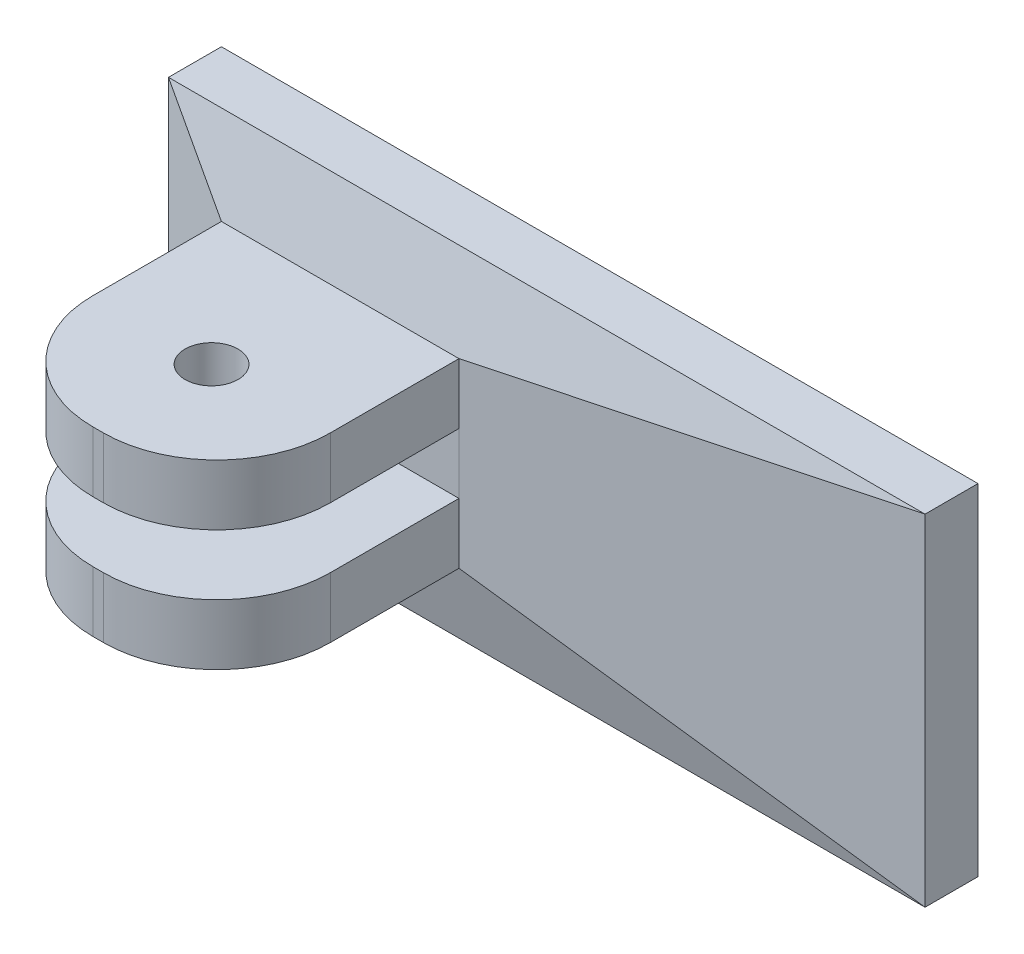
from build123d import *

# Parameters (mm, degrees)
SKETCH1_W           = 100
SKETCH1_H           = 45
BOSS_EXTRUDE1_DEPTH = 10
SKETCH3_W           = 31.4
SKETCH3_H           = 8
BOSS_EXTRUDE2_DEPTH = 5
SKETCH4_R           = 3.5
BOSS_EXTRUDE3_DEPTH = 8
CUT_EXTRUDE1_DEPTH  = 45
CUT_EXTRUDE2_DEPTH  = 100


with BuildPart() as part:
    # Sketch1 → Boss-Extrude1 (new body)
    with BuildSketch(Plane.XY):
        with Locations((26.050004349, -7.647768163)):
            Rectangle(SKETCH1_W, SKETCH1_H)
    extrude(amount=BOSS_EXTRUDE1_DEPTH)

    # Sketch3 → Boss-Extrude2 (add)
    with BuildSketch(Plane.XY.offset(10)):
        with Locations((1.750004349, 0.852231837)):
            Rectangle(SKETCH3_W, SKETCH3_H)
    boss_extrude2 = extrude(amount=BOSS_EXTRUDE2_DEPTH)

    # Sketch4 → Boss-Extrude3 (add)
    with BuildSketch(Plane.XZ.offset(3.147768163)):
        with BuildLine():
            Line((-13.949995651, 15), (-13.949995651, 27))
            ThreePointArc((-13.949995651, 27), (-9.556597369, 37.606601718), (1.050004349, 42))
            Line((1.050004349, 42), (2.450004349, 42))
            ThreePointArc((2.450004349, 42), (13.056606067, 37.606601718), (17.450004349, 27))
            Line((17.450004349, 27), (17.450004349, 15))
            Line((17.450004349, 15), (-13.949995651, 15))
        make_face()
        with Locations((1.744890168, 27)):
            Circle(SKETCH4_R, mode=Mode.SUBTRACT)
    boss_extrude3 = extrude(amount=-BOSS_EXTRUDE3_DEPTH)

    # Mirror1: Boss-Extrude2, Boss-Extrude3 across plane
    add(boss_extrude2.mirror(Plane(origin=(0, -7.147768163, 0), x_dir=(0, 0, 1), z_dir=(0, -1, 0))))
    add(boss_extrude3.mirror(Plane(origin=(0, -7.147768163, 0), x_dir=(0, 0, 1), z_dir=(0, -1, 0))))

    # Sketch5 → Cut-Extrude1 (cut)
    with BuildSketch(Plane.XZ.offset(30.147768163)):
        Polygon((-13.949995651, 10), (-23.949995651, 7), (-23.949995651, 10), align=None)
        Polygon((17.450004349, 10), (76.050004349, 7), (76.050004349, 10), align=None)
    extrude(amount=-CUT_EXTRUDE1_DEPTH, mode=Mode.SUBTRACT)

    # Sketch6 → Cut-Extrude2 (cut)
    with BuildSketch(Plane.ZY.offset(23.949995651)):
        Polygon((7, 14.852231837), (10, 4.852231837), (10, 14.852231837), align=None)
        Polygon((10, -19.147768163), (7, -30.147768163), (10, -30.147768163), align=None)
    extrude(amount=-CUT_EXTRUDE2_DEPTH, mode=Mode.SUBTRACT)


solid = part.part
